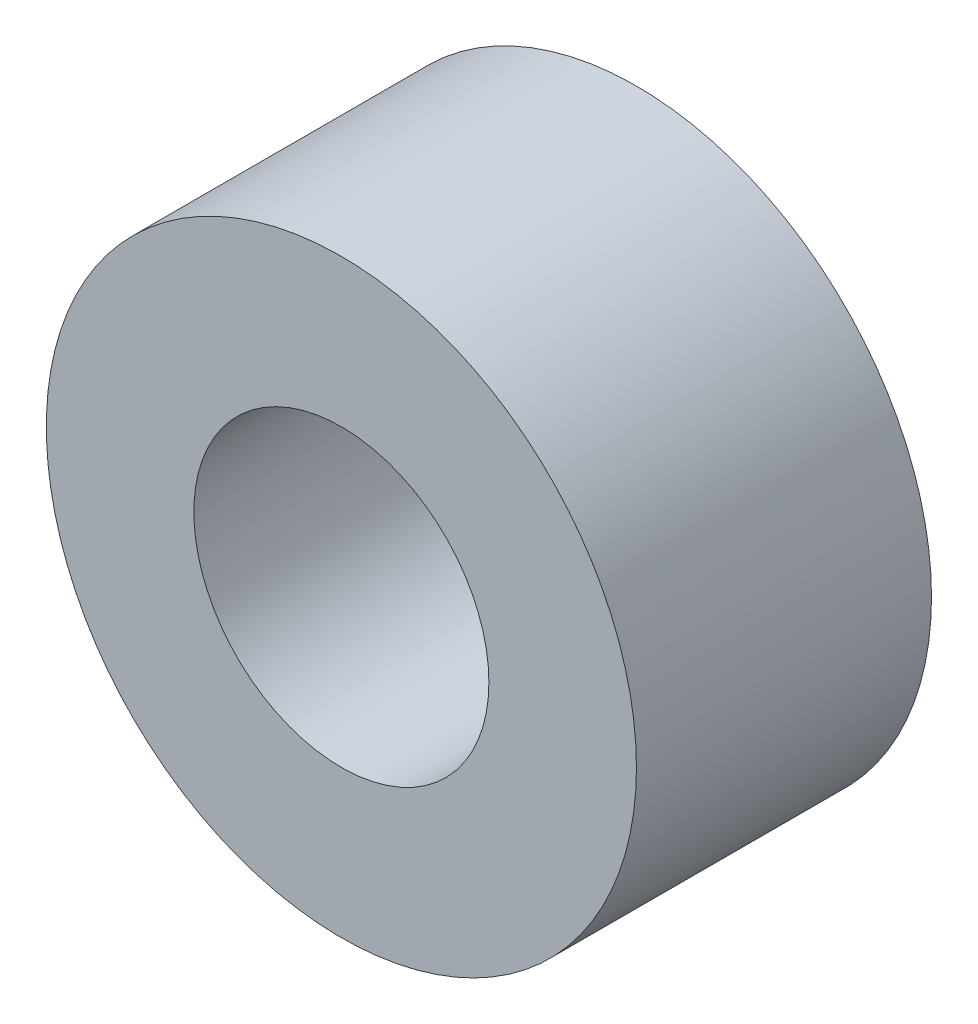
from build123d import *

# Parameters (mm, degrees)
SKETCH_1_R      = 2
SKETCH_1_R_2    = 1
EXTRUDE_2_DEPTH = 2


with BuildPart() as part:
    # 草图1 → 凸台-拉伸2 (new body)
    with BuildSketch(Plane.XY):
        Circle(SKETCH_1_R)
        Circle(SKETCH_1_R_2, mode=Mode.SUBTRACT)
    extrude(amount=EXTRUDE_2_DEPTH)


solid = part.part
